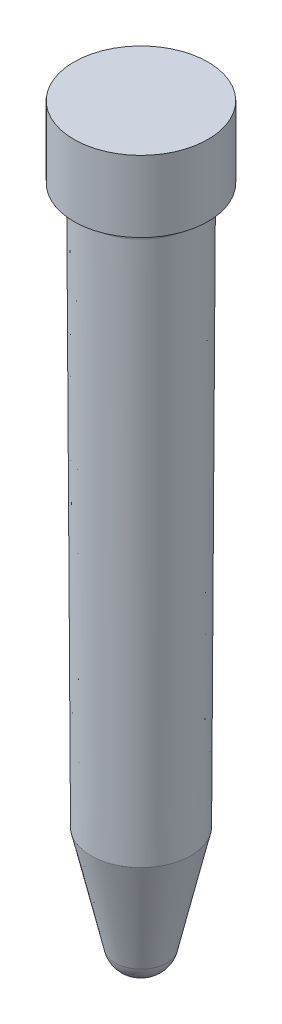
from build123d import *


# Read off the part's stored shape, not the designer's step: Shell1
with BuildPart() as part:
    # Sketch1 → Revolve1 (revolve)
    with BuildSketch(Plane.XY, mode=Mode.PRIVATE) as revolve1_sk:
        with BuildLine():
            Line((10.5, 0), (0, 0))
            Line((0, 0), (0, -117.925892815))
            Line((0, -117.925892815), (0.309007936, -117.925892815))
            ThreePointArc((0.309007936, -117.925892815), (2.721933774, -117.081420898), (4.081671516, -114.916598228))
            Line((4.081671516, -114.916598228), (7.825, -98.498944324))
            Line((7.825, -98.498944324), (8.25, -12.95))
            Line((8.25, -12.95), (8.25, -11.15))
            Line((8.25, -11.15), (10.5, -11.15))
            Line((10.5, -11.15), (10.5, 0))
        make_face()
    revolve(revolve1_sk.sketch.rotate(Axis((0, 0, 0), (0, -1, 0)), 180), axis=Axis((0, 0, 0), (0, -1, 0)))

    # Shell1 outline → Shell1 (revolve, cut)
    with BuildSketch(Plane.XY):
        with BuildLine():
            Line((0, -1), (0, -116.925892815))
            Line((0, -116.925892815), (0.309007936, -116.925892815))
            ThreePointArc((0.309007936, -116.925892815), (2.098355846, -116.299659701), (3.106693462, -114.694297092))
            Line((3.106693462, -114.694297092), (6.825559023, -98.383933749))
            Line((6.825559023, -98.383933749), (7.25, -12.947516057))
            Line((7.25, -12.947516057), (7.25, -10.15))
            Line((7.25, -10.15), (9.5, -10.15))
            Line((9.5, -10.15), (9.5, -1))
            Line((9.5, -1), (0, -1))
        make_face()
    revolve(axis=Axis((0, 0, 0), (0, 1, 0)), mode=Mode.SUBTRACT)


solid = part.part
